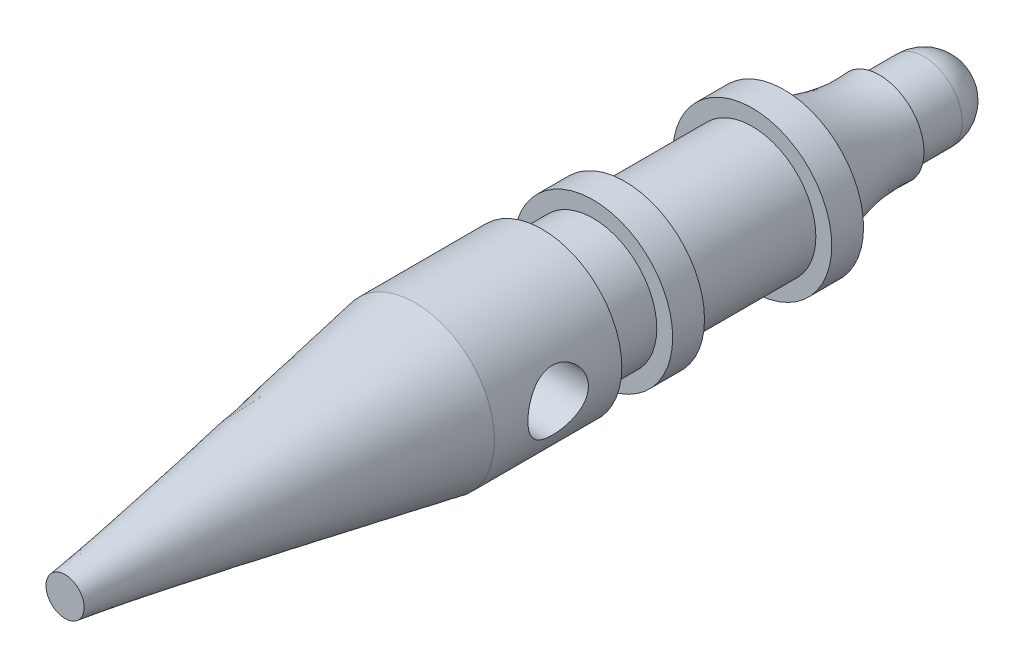
from build123d import *

# Parameters (mm, degrees)
SKETCH1_R               = 6
BOSS_EXTRUDE1_DEPTH     = 7
SKETCH4_R               = 12.5
BOSS_EXTRUDE2_DEPTH     = 5
SKETCH5_R               = 10
BOSS_EXTRUDE3_DEPTH     = 20
SKETCH6_R               = 12.5
BOSS_EXTRUDE4_DEPTH     = 5
SKETCH7_R               = 10
BOSS_EXTRUDE5_DEPTH     = 8
SKETCH8_R               = 12.5
BOSS_EXTRUDE6_DEPTH     = 20
CUT_EXTRUDE1_DEPTH      = 137.152564497
CUT_EXTRUDE1_DEPTH_BACK = 137.152564497
SKETCH12_R              = 4.75


with BuildPart() as part:
    # Sketch1 → Boss-Extrude1 (new body)
    with BuildSketch(Plane.XY):
        Circle(SKETCH1_R)
    extrude(amount=BOSS_EXTRUDE1_DEPTH)

    # Boundary1: read off the stored shape, not the designer's step
    # Boundary1: loft between two sections, ruled curve by curve
    boundary1_from = [
        Edge.make_bspline([(-9.990392453, -0.438244947, 22), (-10.047758582, 0.869494367, 22), (-9.642947539, 3.507763614, 22), (-7.566229655, 6.930521615, 22), (-4.338335116, 9.298440939, 22), (-0.449636643, 10.250837553, 22), (3.507374728, 9.642622793, 22), (6.930425472, 7.566400094, 22), (9.298503644, 4.338285256, 22), (10.250777835, 0.449667179, 22), (9.642667481, -3.507399725, 22), (7.566354672, -6.930475061, 22), (4.338256441, -9.298461316, 22), (0.449702826, -10.25083465, 22), (-3.507454885, -9.642609382, 22), (-6.930296859, -7.566435522, 22), (-9.298750763, -4.33867227, 22), (-9.933026324, -1.745984261, 22), (-9.990392453, -0.438244947, 22)], [0, 0, 0, 0, 0.0625, 0.125, 0.1875, 0.25, 0.3125, 0.375, 0.4375, 0.5, 0.5625, 0.625, 0.6875, 0.75, 0.8125, 0.875, 0.9375, 1, 1, 1, 1], 3),
    ]
    boundary1_to = [
        Edge.make_bspline([(-4.22566792, 5.580656828, 7), (-3.49516165, 6.133795465, 7), (-1.81439525, 6.949853324, 7), (0.983209382, 7.114837867, 7), (3.63097391, 6.197052468, 7), (5.726187747, 4.335834577, 7), (6.949450421, 1.814506667, 7), (7.11490288, -0.983090952, 7), (6.197074461, -3.631038197, 7), (4.335815401, -5.72612384, 7), (1.814508513, -6.949512869, 7), (-0.983112034, -7.114899967, 7), (-3.631019486, -6.197014853, 7), (-5.726159627, -4.335871713, 7), (-6.949474267, -1.814452599, 7), (-7.114869505, 0.982980413, 7), (-6.197432873, 3.6310215, 7), (-4.956174191, 5.02751819, 7), (-4.22566792, 5.580656828, 7)], [0, 0, 0, 0, 0.0625, 0.125, 0.1875, 0.25, 0.3125, 0.375, 0.4375, 0.5, 0.5625, 0.625, 0.6875, 0.75, 0.8125, 0.875, 0.9375, 1, 1, 1, 1], 3),
    ]
    boundary1 = Solid(Shell([*[Face.make_surface_from_curves(boundary1_from[k], boundary1_to[k]) for k in range(1)], Face(Wire(boundary1_from)), Face(Wire(boundary1_to))]))
    add(boundary1)

    # Sketch4 → Boss-Extrude2 (add)
    with BuildSketch(Plane.XY.offset(22)):
        Circle(SKETCH4_R)
    extrude(amount=BOSS_EXTRUDE2_DEPTH)

    # Sketch5 → Boss-Extrude3 (add)
    with BuildSketch(Plane.XY.offset(27)):
        Circle(SKETCH5_R)
    extrude(amount=BOSS_EXTRUDE3_DEPTH)

    # Sketch6 → Boss-Extrude4 (add)
    with BuildSketch(Plane.XY.offset(47)):
        Circle(SKETCH6_R)
    extrude(amount=BOSS_EXTRUDE4_DEPTH)

    # Sketch7 → Boss-Extrude5 (add)
    with BuildSketch(Plane.XY.offset(52)):
        Circle(SKETCH7_R)
    extrude(amount=BOSS_EXTRUDE5_DEPTH)

    # Sketch8 → Boss-Extrude6 (add)
    with BuildSketch(Plane.XY.offset(60)):
        Circle(SKETCH8_R)
    extrude(amount=BOSS_EXTRUDE6_DEPTH)

    # Boundary2: read off the stored shape, not the designer's step
    # Boundary2: loft between two sections, ruled curve by curve
    boundary2_from = [
        Edge.make_bspline([(-0.413243211, -2.971402034, 135), (-0.802198828, -2.917308624, 135), (-1.558617548, -2.654581098, 135), (-2.455702084, -1.855996132, 135), (-2.979045824, -0.775030925, 135), (-3.048865186, 0.4240263, 135), (-2.654518323, 1.558486334, 135), (-1.856054801, 2.455684477, 135), (-0.775042701, 2.979060904, 135), (0.424014143, 3.048849818, 135), (1.558524876, 2.654523549, 135), (2.455700435, 1.856033687, 135), (2.97904536, 0.775007047, 135), (3.04886792, -0.424006642, 135), (2.654512254, -1.558509432, 135), (1.856066634, -2.455648798, 135), (0.775116152, -2.979141557, 135), (-0.024287594, -3.025495444, 135), (-0.413243211, -2.971402034, 135)], [0, 0, 0, 0, 0.0625, 0.125, 0.1875, 0.25, 0.3125, 0.375, 0.4375, 0.5, 0.5625, 0.625, 0.6875, 0.75, 0.8125, 0.875, 0.9375, 1, 1, 1, 1], 3),
    ]
    boundary2_to = [
        Edge.make_bspline([(-8.575853055, -9.094214886, 80), (-9.766282999, -7.971638346, 80), (-11.701089645, -5.253470626, 80), (-12.820274794, -0.375962681, 80), (-11.988422629, 4.558603883, 80), (-9.331271608, 8.799453385, 80), (-5.253613651, 11.700519429, 80), (-0.376084461, 12.82034826, 80), (4.558634158, 11.988426255, 80), (8.79939251, 9.331266038, 80), (11.700579622, 5.253565072, 80), (12.820347791, 0.376100432, 80), (11.988369013, -4.558686182, 80), (9.331327134, -8.799394503, 80), (5.253534637, -11.700577777, 80), (0.376217696, -12.820267313, 80), (-4.558509976, -11.988929864, 80), (-7.38542311, -10.216791425, 80), (-8.575853055, -9.094214886, 80)], [0, 0, 0, 0, 0.0625, 0.125, 0.1875, 0.25, 0.3125, 0.375, 0.4375, 0.5, 0.5625, 0.625, 0.6875, 0.75, 0.8125, 0.875, 0.9375, 1, 1, 1, 1], 3),
    ]
    boundary2 = Solid(Shell([*[Face.make_surface_from_curves(boundary2_from[k], boundary2_to[k]) for k in range(1)], Face(Wire(boundary2_from)), Face(Wire(boundary2_to))]))
    add(boundary2)

    # Sketch12 → Cut-Extrude1 (cut, two sides: drawn at the far end of the back side and taken through both)
    with BuildSketch(Plane(origin=(0, 0, 0), x_dir=(0, 0, -1), z_dir=(1, 0, 0)).offset(-CUT_EXTRUDE1_DEPTH_BACK)):
        with Locations((-70, 0)):
            Circle(SKETCH12_R)
    extrude(amount=CUT_EXTRUDE1_DEPTH + CUT_EXTRUDE1_DEPTH_BACK, mode=Mode.SUBTRACT)

    # Sketch17 → Revolve1 (revolve)
    with BuildSketch(Plane(origin=(0, 0, 0), x_dir=(0, 0, -1), z_dir=(1, 0, 0))):
        with BuildLine():
            Line((0, 6), (0, -6))
            ThreePointArc((0, -6), (6, 0), (0, 6))
        make_face()
    revolve(axis=Axis((0, 6, 0), (0, -1, 0)))


solid = part.part
